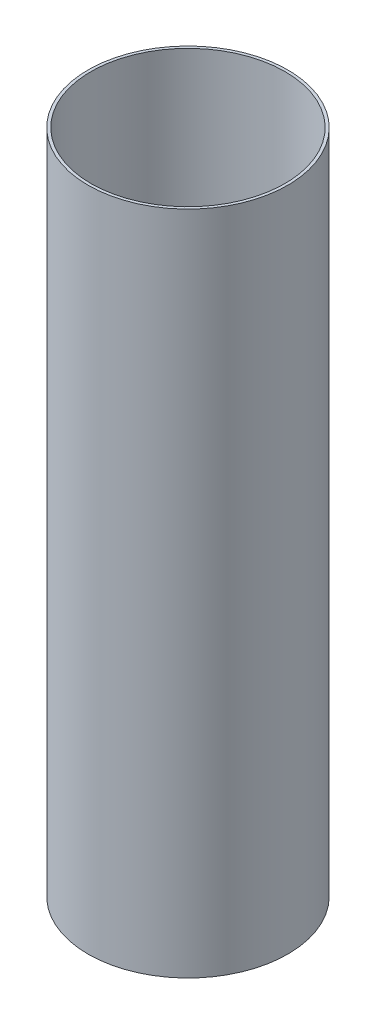
from build123d import *

# Parameters (mm, degrees)
SKETCH_1_R      = 52.5
SKETCH_1_R_2    = 51
EXTRUDE_1_DEPTH = 350


with BuildPart() as part:
    # Эскиз1 → Бобышка-Вытянуть1 (new body)
    with BuildSketch(Plane(origin=(0, 0, 0), x_dir=(1, 0, 0), z_dir=(0, 1, 0))):
        Circle(SKETCH_1_R)
        Circle(SKETCH_1_R_2, mode=Mode.SUBTRACT)
    extrude(amount=EXTRUDE_1_DEPTH)


solid = part.part
